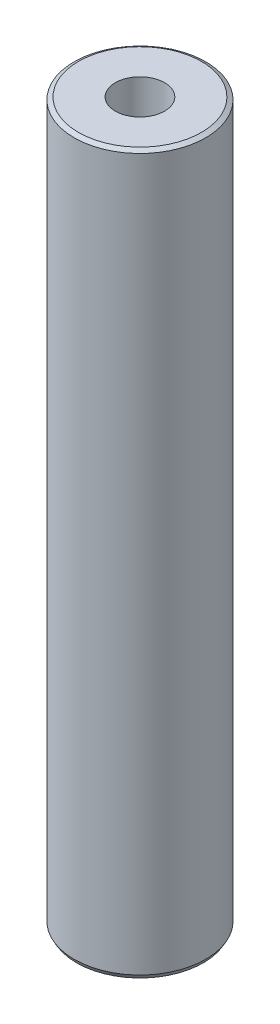
from build123d import *
from OCP.BRepFilletAPI import BRepFilletAPI_MakeChamfer

# Parameters (mm, degrees)
SKETCH1_R           = 55
BOSS_EXTRUDE1_DEPTH = 600
SKETCH2_R           = 20.602528373
CUT_EXTRUDE1_DEPTH  = 606.020660804
CHAMFER1_SIZE       = 2.054547035
CHAMFER1_SIZE2      = 3.611838507


with BuildPart() as part:
    # Sketch1 → Boss-Extrude1 (new body)
    with BuildSketch(Plane(origin=(0, 0, 0), x_dir=(1, 0, 0), z_dir=(0, 1, 0))):
        Circle(SKETCH1_R)
    extrude(amount=BOSS_EXTRUDE1_DEPTH)

    # Sketch2 → Cut-Extrude1 (cut, through all)
    with BuildSketch(Plane(origin=(0, 0, 0), x_dir=(1, 0, 0), z_dir=(0, 1, 0))):
        Circle(SKETCH2_R)
    extrude(amount=CUT_EXTRUDE1_DEPTH, mode=Mode.SUBTRACT)

    # Chamfer1: one chamfer whose edges measure the first distance from different faces: ONE call of the kernel's chamfer builder (chamfer() names one face for all edges)
    chamfer1_edges_1 = [part.edges().sort_by_distance(p)[0] for p in [
        (-55, 600, 0),
    ]]
    chamfer1_side_1 = [part.faces().sort_by_distance(p)[0] for p in [
        (-55, 300, 0),
    ]]
    chamfer1_edges_2 = [part.edges().sort_by_distance(p)[0] for p in [
        (-55, 0, 0),
    ]]
    chamfer1_side_2 = [part.faces().sort_by_distance(p)[0] for p in [
        (-53.444365081, 0, 0),
    ]]
    chamfer1 = BRepFilletAPI_MakeChamfer(part.part.solid().wrapped)
    for e in chamfer1_edges_1:
        chamfer1.Add(CHAMFER1_SIZE, CHAMFER1_SIZE2, e.wrapped, chamfer1_side_1[0].wrapped)  # the first distance lies on this face
    for e in chamfer1_edges_2:
        chamfer1.Add(CHAMFER1_SIZE, CHAMFER1_SIZE2, e.wrapped, chamfer1_side_2[0].wrapped)  # the first distance lies on this face
    add(Compound.cast(chamfer1.Shape()), mode=Mode.REPLACE)


solid = part.part
